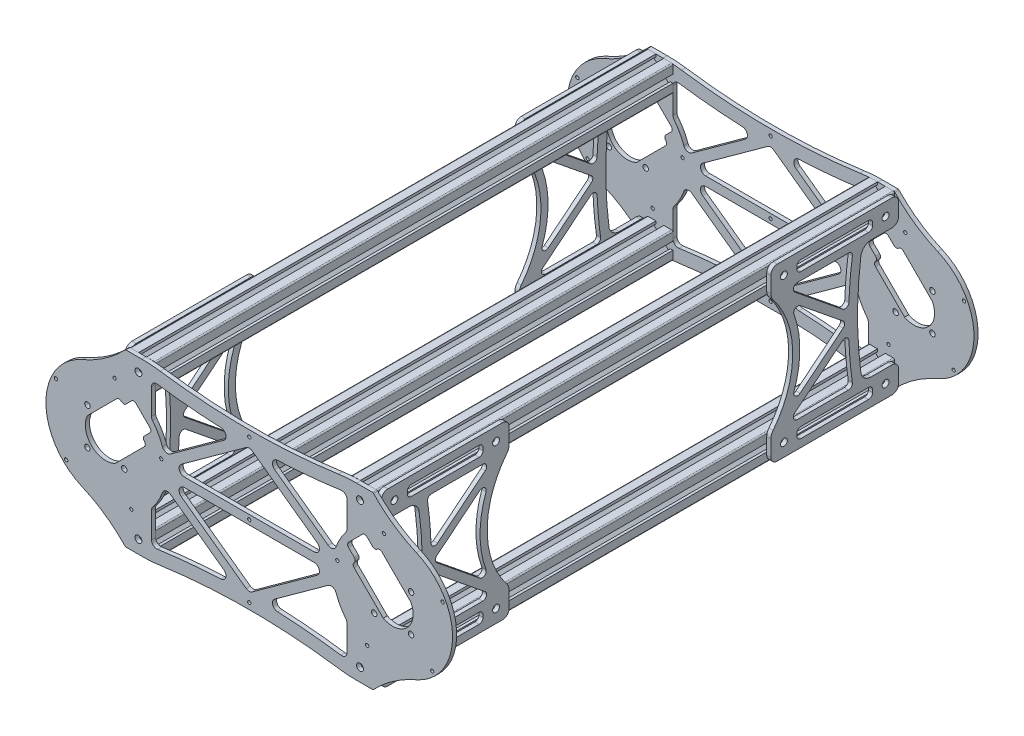
from build123d import *

# Parameters (mm, degrees)
MOTOR_START                           = -31.175
MOTOR_PATTERN_OUTLINE_R               = 46
MOTOR_PATTERN_OUTLINE_R_2             = 1.245
MOTOR_PATTERN_OUTLINE_R_3             = 2.1
MOTOR_PATTERN_DEPTH                   = 3.175
SKETCH1_R                             = 2.65
END_PLATE_CONNECT_DEPTH               = 3.175
END_PLATE_HOLLOWING_DEPTH             = 170.217163245
END_PLATE_HOLLOWING_DEPTH_BACK        = 170.217163245
END_PLATE_TRUSS_DEPTH                 = 3.175
M3X0_5_TAPPED_HOLE1_D                 = 2.49
END_PLATE_TRUSS_FILLET_R              = 4
END_PLATE_BIG_FILLET_R                = 100
END_PLATE_EXTRUSION_CORNER_FILLET_R   = 1
END_PLATE_EXTRUSION_CORNER_FILLET_2_R = 100
SKETCH13_R                            = 2.1
EXTRUSIONS_DEPTH                      = 396.825
SKETCH13_ON_SEGMENT_2_R               = 2.1
EXTRUSIONS_2_DEPTH                    = 396.825
SKETCH13_ON_SEGMENT_3_R               = 2.1
EXTRUSIONS_3_DEPTH                    = 396.825
SKETCH13_ON_SEGMENT_4_R               = 2.1
EXTRUSIONS_4_DEPTH                    = 396.825
SIDE_PLATE_EXTRUDE_DEPTH              = 3.175
SKETCH15_W                            = 8
SKETCH15_H                            = 58
SIDE_PLATE_HOLLOWING_DEPTH            = 3.175
SIDE_PLATE_TRUSS_DEPTH                = 3.175
SKETCH18_R                            = 2.65
SIDE_PLATE_M5_HOLES_DEPTH             = 3.175
SIDE_PLATE_TRUSS_FILLET_R             = 3
SIDE_PLATE_CORNER_FILLET_R            = 5
SIDE_PLATE_INNER_CORNER_FILLET_R      = 8
I_DESIGNED_EVERYTHING_BAD_OOPS_ANGLE  = 90


# Read off the part's stored shape, not the designer's step: motor pattern
with BuildPart() as part:
    # motor pattern outline → motor pattern (new body)
    with BuildSketch(Plane.XY.offset(MOTOR_START)):
        Circle(MOTOR_PATTERN_OUTLINE_R)
        with Locations((-38.31328054, -19.521591489)):
            Circle(MOTOR_PATTERN_OUTLINE_R_2, mode=Mode.SUBTRACT)
        with Locations((-14.142135624, -14.142135624)):
            Circle(MOTOR_PATTERN_OUTLINE_R_3, mode=Mode.SUBTRACT)
        with Locations((6.726681997, -42.470598646)):
            Circle(MOTOR_PATTERN_OUTLINE_R_2, mode=Mode.SUBTRACT)
        with BuildLine():
            ThreePointArc((11.844038585, -29.521708115), (10.076271632, -30.253941162), (8.308504679, -29.521708115))
            Line((8.308504679, -29.521708115), (-14.002371145, -7.210832291))
            ThreePointArc((-14.002371145, -7.210832291), (-11.136931804, 11.136931804), (7.210832291, 14.002371145))
            Line((7.210832291, 14.002371145), (29.521708115, -8.308504679))
            ThreePointArc((29.521708115, -8.308504679), (30.253941162, -10.076271632), (29.521708115, -11.844038585))
            ThreePointArc((29.521708115, -11.844038585), (28.789475068, -13.611805538), (29.521708115, -15.379572491))
            Line((29.521708115, -15.379572491), (33.764348802, -19.622213178))
            ThreePointArc((33.764348802, -19.622213178), (34.496581849, -21.389980131), (33.764348802, -23.157747084))
            Line((33.764348802, -23.157747084), (23.157747084, -33.764348802))
            ThreePointArc((23.157747084, -33.764348802), (21.389980131, -34.496581849), (19.622213178, -33.764348802))
            Line((19.622213178, -33.764348802), (15.379572491, -29.521708115))
            ThreePointArc((15.379572491, -29.521708115), (13.611805538, -28.789475068), (11.844038585, -29.521708115))
        make_face(mode=Mode.SUBTRACT)
        with Locations((42.470598646, -6.726681997)):
            Circle(MOTOR_PATTERN_OUTLINE_R_2, mode=Mode.SUBTRACT)
        with Locations((-14.142135624, 14.142135624)):
            Circle(MOTOR_PATTERN_OUTLINE_R_3, mode=Mode.SUBTRACT)
        with Locations((-30.405591591, 30.405591591)):
            Circle(MOTOR_PATTERN_OUTLINE_R_2, mode=Mode.SUBTRACT)
        with Locations((14.142135624, 14.142135624)):
            Circle(MOTOR_PATTERN_OUTLINE_R_3, mode=Mode.SUBTRACT)
        with Locations((19.521591489, 38.31328054)):
            Circle(MOTOR_PATTERN_OUTLINE_R_2, mode=Mode.SUBTRACT)
    extrude(amount=MOTOR_PATTERN_DEPTH)


with BuildPart() as part_1:
    # motor pattern move: moved
    add(part.part.moved(Location((0, 110, 0))))


with BuildPart() as body_2:
    # end plate motor pattern: mirrored copy
    add(part_1.part.mirror(Plane.ZX))


with BuildPart() as part_2:
    add(part_1.part)

    # Sketch1 → end plate connect (add)
    with BuildSketch(Plane(origin=(0, 0, -31.175), x_dir=(-1, 0, 0), z_dir=(0, 0, -1))):
        with BuildLine():
            Line((45.48562981, 95), (43.48562981, 95))
            ThreePointArc((43.48562981, 95), (0, 64), (-43.48562981, 95))
            Line((-43.48562981, 95), (-65.48562981, 95))
            Line((-65.48562981, 95), (-65.48562981, 0))
            Line((-65.48562981, 0), (65.48562981, 0))
            Line((65.48562981, 0), (65.48562981, 75))
            Line((65.48562981, 75), (65.48562981, 95))
            Line((65.48562981, 95), (45.48562981, 95))
        make_face()
        with Locations(Location((-55.48562981, 85, 0), (0, 0, 90))):
            Circle(SKETCH1_R, mode=Mode.SUBTRACT)
        with Locations(Location((55.48562981, 85, 0), (0, 0, 90))):
            Circle(SKETCH1_R, mode=Mode.SUBTRACT)
    end_plate_connect = extrude(amount=-END_PLATE_CONNECT_DEPTH)

    # end plate connect mirror: end plate connect across plane
    add(end_plate_connect.mirror(Plane(origin=(0, 0, -28), x_dir=(0, 0, 1), z_dir=(0, 1, 0))))

    # end plate combine: union body 2
    add(body_2.part)

    # Sketch2 → end plate hollowing (cut, two sides: drawn at the far end of the back side and taken through both)
    with BuildSketch(Plane(origin=(0, 0, -31.175), x_dir=(-1, 0, 0), z_dir=(0, 0, -1)).offset(-END_PLATE_HOLLOWING_DEPTH_BACK)):
        with BuildLine():
            ThreePointArc((-55.48562981, 75), (-49.828628142, 0), (-55.48562981, -75))
            Line((-55.48562981, -75), (-29.849623113, -75))
            ThreePointArc((-29.849623113, -75), (0, -64), (29.849623113, -75))
            Line((29.849623113, -75), (55.48562981, -75))
            ThreePointArc((55.48562981, -75), (49.828628142, 0), (55.48562981, 75))
            Line((55.48562981, 75), (29.849623113, 75))
            ThreePointArc((29.849623113, 75), (0, 64), (-29.849623113, 75))
            Line((-29.849623113, 75), (-55.48562981, 75))
        make_face()
        with BuildLine():
            Line((-65.48562981, 75), (-65.48562981, -75))
            ThreePointArc((-65.48562981, -75), (-59.713192726, 0), (-65.48562981, 75))
        make_face()
        with BuildLine():
            ThreePointArc((65.48562981, 75), (59.713192726, 0), (65.48562981, -75))
            Line((65.48562981, -75), (65.48562981, 75))
        make_face()
    extrude(amount=END_PLATE_HOLLOWING_DEPTH + END_PLATE_HOLLOWING_DEPTH_BACK, mode=Mode.SUBTRACT)

    # Sketch3 → end plate truss (add)
    with BuildSketch(Plane(origin=(0, 0, -31.175), x_dir=(-1, 0, 0), z_dir=(0, 0, -1))):
        with BuildLine():
            ThreePointArc((-55.664042461, 2.051932173), (-52.828628142, 3.5), (-49.993213824, 2.051932173))
            Line((-49.993213824, 2.051932173), (-48.508271882, 0))
            Line((-48.508271882, 0), (-3.5, 62.193624232))
            Line((-3.5, 62.193624232), (-3.5, 64.133345446))
            ThreePointArc((-3.5, 64.133345446), (-6.783579024, 64.502933549), (-10.032155015, 65.107284937))
            Line((-10.032155015, 65.107284937), (-55.664042461, 2.051932173))
        make_face()
        with BuildLine():
            Line((-3.5, 62.193624232), (-3.5, -62.193624232))
            Line((-3.5, -62.193624232), (-2.156172123, -64.050561246))
            ThreePointArc((-2.156172123, -64.050561246), (0, -64), (2.156172123, -64.050561246))
            Line((2.156172123, -64.050561246), (3.5, -62.193624232))
            Line((3.5, -62.193624232), (3.5, 62.193624232))
            Line((3.5, 62.193624232), (2.156172123, 64.050561246))
            ThreePointArc((2.156172123, 64.050561246), (0, 64), (-2.156172123, 64.050561246))
            Line((-2.156172123, 64.050561246), (-3.5, 62.193624232))
        make_face()
        with BuildLine():
            Line((3.5, 64.133345446), (3.5, 62.193624232))
            Line((3.5, 62.193624232), (48.508271882, 0))
            Line((48.508271882, 0), (49.993213824, 2.051932173))
            ThreePointArc((49.993213824, 2.051932173), (52.828628142, 3.5), (55.664042461, 2.051932173))
            Line((55.664042461, 2.051932173), (10.032155015, 65.107284937))
            ThreePointArc((10.032155015, 65.107284937), (6.783579024, 64.502933549), (3.5, 64.133345446))
        make_face()
        with BuildLine():
            ThreePointArc((3.5, 64.133345446), (2.828388955, 64.087036516), (2.156172123, 64.050561246))
            Line((2.156172123, 64.050561246), (3.5, 62.193624232))
            Line((3.5, 62.193624232), (3.5, 64.133345446))
        make_face()
        with BuildLine():
            Line((-3.5, 64.133345446), (-3.5, 62.193624232))
            Line((-3.5, 62.193624232), (-2.156172123, 64.050561246))
            ThreePointArc((-2.156172123, 64.050561246), (-2.828388955, 64.087036516), (-3.5, 64.133345446))
        make_face()
        with BuildLine():
            Line((-48.508271882, 0), (-49.993213824, 2.051932173))
            ThreePointArc((-49.993213824, 2.051932173), (-52.828628142, 3.5), (-55.664042461, 2.051932173))
            ThreePointArc((-55.664042461, 2.051932173), (-56.328628142, 0), (-55.664042461, -2.051932173))
            ThreePointArc((-55.664042461, -2.051932173), (-52.828628142, -3.5), (-49.993213824, -2.051932173))
            Line((-49.993213824, -2.051932173), (-48.508271882, 0))
        make_face()
        with BuildLine():
            Line((-3.5, -62.193624232), (-48.508271882, 0))
            Line((-48.508271882, 0), (-49.993213824, -2.051932173))
            ThreePointArc((-49.993213824, -2.051932173), (-52.828628142, -3.5), (-55.664042461, -2.051932173))
            Line((-55.664042461, -2.051932173), (-10.032155015, -65.107284937))
            ThreePointArc((-10.032155015, -65.107284937), (-6.783579024, -64.502933549), (-3.5, -64.133345446))
            Line((-3.5, -64.133345446), (-3.5, -62.193624232))
        make_face()
        with BuildLine():
            Line((49.993213824, 2.051932173), (48.508271882, 0))
            Line((48.508271882, 0), (49.993213824, -2.051932173))
            ThreePointArc((49.993213824, -2.051932173), (52.828628142, -3.5), (55.664042461, -2.051932173))
            ThreePointArc((55.664042461, -2.051932173), (56.328628142, 0), (55.664042461, 2.051932173))
            ThreePointArc((55.664042461, 2.051932173), (52.828628142, 3.5), (49.993213824, 2.051932173))
        make_face()
        with BuildLine():
            Line((48.508271882, 0), (3.5, -62.193624232))
            Line((3.5, -62.193624232), (3.5, -64.133345446))
            ThreePointArc((3.5, -64.133345446), (6.783579024, -64.502933549), (10.032155015, -65.107284937))
            Line((10.032155015, -65.107284937), (55.664042461, -2.051932173))
            ThreePointArc((55.664042461, -2.051932173), (52.828628142, -3.5), (49.993213824, -2.051932173))
            Line((49.993213824, -2.051932173), (48.508271882, 0))
        make_face()
        with BuildLine():
            Line((-2.156172123, -64.050561246), (-3.5, -62.193624232))
            Line((-3.5, -62.193624232), (-3.5, -64.133345446))
            ThreePointArc((-3.5, -64.133345446), (-2.828388955, -64.087036516), (-2.156172123, -64.050561246))
        make_face()
        with BuildLine():
            Line((3.5, -62.193624232), (2.156172123, -64.050561246))
            ThreePointArc((2.156172123, -64.050561246), (2.828388955, -64.087036516), (3.5, -64.133345446))
            Line((3.5, -64.133345446), (3.5, -62.193624232))
        make_face()
    extrude(amount=-END_PLATE_TRUSS_DEPTH)

    # M3x0.5 Tapped Hole1 (through all)
    with Locations(Plane(origin=(0, 0, -31.175), x_dir=(-1, 0, 0), z_dir=(0, 0, -1))):
        with Locations((-55, 0), (0, 0), (55, 0)):
            Hole(M3X0_5_TAPPED_HOLE1_D / 2)

    # end plate truss fillet
    end_plate_truss_fillet_edges = [part_2.edges().sort_by_distance(p)[0] for p in [
        (-55.48562981, -75, -29.5875),
        (-29.849623113, -75, -29.5875),
        (29.849623113, -75, -29.5875),
        (55.48562981, -75, -29.5875),
        (55.48562981, 75, -29.5875),
        (29.849623113, 75, -29.5875),
        (-29.849623113, 75, -29.5875),
        (-55.48562981, 75, -29.5875),
        (-49.928196083, -9.977876879, -29.5875),
        (-49.928196083, 9.977876879, -29.5875),
        (49.928196083, -9.977876879, -29.5875),
        (10.032155015, -65.107284937, -29.5875),
        (49.928196083, 9.977876879, -29.5875),
        (-10.032155015, 65.107284937, -29.5875),
        (-3.5, -62.193624232, -29.5875),
        (-3.5, 62.193624232, -29.5875),
        (-48.508271882, 0, -29.5875),
        (10.032155015, 65.107284937, -29.5875),
        (-10.032155015, -65.107284937, -29.5875),
        (48.508271882, 0, -29.5875),
        (3.5, 62.193624232, -29.5875),
        (3.5, -62.193624232, -29.5875),
    ]]
    fillet(end_plate_truss_fillet_edges, radius=END_PLATE_TRUSS_FILLET_R)

    # end plate big fillet
    # the kernel refuses this fillet: 100 mm, written as the material it adds along each edge
    with BuildSketch(Plane(origin=(43.48562981, 95, -31.175), x_dir=(1, 0, 0), z_dir=(0, 0, 1))) as end_plate_big_fillet_piece_1:
        with BuildLine():
            CenterArc((90.605076646, 72.755367213), END_PLATE_BIG_FILLET_R, 203.302445724, 23.379254169)
            ThreePointArc((-1.237872981, 33.196896519), (2.482423018, 16.714094285), (0, 0))
            Line((0, 0), (22, 0))
        make_face()
    extrude(amount=3.175)
    with BuildSketch(Plane(origin=(-43.48562981, 95, -31.175), x_dir=(-1, 0, 0), z_dir=(0, 0, 1))) as end_plate_big_fillet_piece_2:
        with BuildLine():
            CenterArc((90.605076646, -72.755367213), END_PLATE_BIG_FILLET_R, 133.318300107, 23.379254169)
            ThreePointArc((-1.237872981, -33.196896519), (2.482423018, -16.714094285), (0, 0))
            Line((0, 0), (22, 0))
        make_face()
    extrude(amount=3.175)
    with BuildSketch(Plane(origin=(-43.48562981, -95, -31.175), x_dir=(0.03726291924188366, -0.9993054962570621, 0), z_dir=(0, 0, 1))) as end_plate_big_fillet_piece_3:
        with BuildLine():
            CenterArc((69.328628684, -93.253228454), END_PLATE_BIG_FILLET_R, 111.166943324, 23.379254169)
            Line((-0.819784223, -21.984720918), (0, 0))
            ThreePointArc((0, 0), (16.609983956, -3.103514911), (33.219967911, 0))
        make_face()
    extrude(amount=3.175)
    with BuildSketch(Plane(origin=(43.48562981, -95, -31.175), x_dir=(-0.03726291924188323, -0.9993054962570621, 0), z_dir=(0, 0, 1))) as end_plate_big_fillet_piece_4:
        with BuildLine():
            CenterArc((69.328628684, 93.253228454), END_PLATE_BIG_FILLET_R, 225.453802506, 23.379254169)
            Line((-0.819784223, 21.984720918), (0, 0))
            ThreePointArc((0, 0), (16.609983956, 3.103514911), (33.219967911, 0))
        make_face()
    extrude(amount=3.175)

    # end plate extrusion corner fillet
    end_plate_extrusion_corner_fillet_edges = [part_2.edges().sort_by_distance(p)[0] for p in [
        (-65.48562981, 95, -29.5875),
        (65.48562981, 95, -29.5875),
        (65.48562981, -95, -29.5875),
        (-65.48562981, -95, -29.5875),
    ]]
    fillet(end_plate_extrusion_corner_fillet_edges, radius=END_PLATE_EXTRUSION_CORNER_FILLET_R)

    # end plate extrusion corner fillet 2
    end_plate_extrusion_corner_fillet_2_edges = [part_2.edges().sort_by_distance(p)[0] for p in [
        (-65.48562981, 75, -29.5875),
        (-65.48562981, -75, -29.5875),
        (65.48562981, -75, -29.5875),
        (65.48562981, 75, -29.5875),
    ]]
    fillet(end_plate_extrusion_corner_fillet_2_edges, radius=END_PLATE_EXTRUSION_CORNER_FILLET_2_R)


with BuildPart() as body_2_2:
    # end plate copy: copy of part
    add(part_2.part.moved(Location((0, 0, 400))))


with BuildPart() as body_3:
    # Sketch13 → extrusions (new body)
    with BuildSketch(Plane(origin=(55.48562981, 85, -28), x_dir=(1, 0, 0), z_dir=(0, 0, 1))):
        with BuildLine():
            Line((-3, 10), (-9, 10))
            ThreePointArc((-9, 10), (-9.707106781, 9.707106781), (-10, 9))
            Line((-10, 9), (-10, 3))
            Line((-10, 3), (-8, 3))
            Line((-8, 3), (-8, 6))
            Line((-8, 6), (-4, 2))
            Line((-4, 2), (-4, -2))
            Line((-4, -2), (-8, -6))
            Line((-8, -6), (-8, -3))
            Line((-8, -3), (-10, -3))
            Line((-10, -3), (-10, -9))
            ThreePointArc((-10, -9), (-9.707106781, -9.707106781), (-9, -10))
            Line((-9, -10), (-3, -10))
            Line((-3, -10), (-3, -8))
            Line((-3, -8), (-6, -8))
            Line((-6, -8), (-2, -4))
            Line((-2, -4), (2, -4))
            Line((2, -4), (6, -8))
            Line((6, -8), (3, -8))
            Line((3, -8), (3, -10))
            Line((3, -10), (9, -10))
            ThreePointArc((9, -10), (9.707106781, -9.707106781), (10, -9))
            Line((10, -9), (10, -3))
            Line((10, -3), (8, -3))
            Line((8, -3), (8, -6))
            Line((8, -6), (4, -2))
            Line((4, -2), (4, 2))
            Line((4, 2), (8, 6))
            Line((8, 6), (8, 3))
            Line((8, 3), (10, 3))
            Line((10, 3), (10, 9))
            ThreePointArc((10, 9), (9.707106781, 9.707106781), (9, 10))
            Line((9, 10), (3, 10))
            Line((3, 10), (3, 8))
            Line((3, 8), (6, 8))
            Line((6, 8), (2, 4))
            Line((2, 4), (-2, 4))
            Line((-2, 4), (-6, 8))
            Line((-6, 8), (-3, 8))
            Line((-3, 8), (-3, 10))
        make_face()
        Circle(SKETCH13_R, mode=Mode.SUBTRACT)
    extrude(amount=EXTRUSIONS_DEPTH)


with BuildPart() as body_4:
    # Sketch13 on segment 2 (carried to segment 2) → extrusions 2 (new body)
    with BuildSketch(Plane(origin=(55.48562981, -85, -28), x_dir=(1, 0, 0), z_dir=(0, 0, 1))):
        with BuildLine():
            Line((-3, 10), (-9, 10))
            ThreePointArc((-9, 10), (-9.707106781, 9.707106781), (-10, 9))
            Line((-10, 9), (-10, 3))
            Line((-10, 3), (-8, 3))
            Line((-8, 3), (-8, 6))
            Line((-8, 6), (-4, 2))
            Line((-4, 2), (-4, -2))
            Line((-4, -2), (-8, -6))
            Line((-8, -6), (-8, -3))
            Line((-8, -3), (-10, -3))
            Line((-10, -3), (-10, -9))
            ThreePointArc((-10, -9), (-9.707106781, -9.707106781), (-9, -10))
            Line((-9, -10), (-3, -10))
            Line((-3, -10), (-3, -8))
            Line((-3, -8), (-6, -8))
            Line((-6, -8), (-2, -4))
            Line((-2, -4), (2, -4))
            Line((2, -4), (6, -8))
            Line((6, -8), (3, -8))
            Line((3, -8), (3, -10))
            Line((3, -10), (9, -10))
            ThreePointArc((9, -10), (9.707106781, -9.707106781), (10, -9))
            Line((10, -9), (10, -3))
            Line((10, -3), (8, -3))
            Line((8, -3), (8, -6))
            Line((8, -6), (4, -2))
            Line((4, -2), (4, 2))
            Line((4, 2), (8, 6))
            Line((8, 6), (8, 3))
            Line((8, 3), (10, 3))
            Line((10, 3), (10, 9))
            ThreePointArc((10, 9), (9.707106781, 9.707106781), (9, 10))
            Line((9, 10), (3, 10))
            Line((3, 10), (3, 8))
            Line((3, 8), (6, 8))
            Line((6, 8), (2, 4))
            Line((2, 4), (-2, 4))
            Line((-2, 4), (-6, 8))
            Line((-6, 8), (-3, 8))
            Line((-3, 8), (-3, 10))
        make_face()
        Circle(SKETCH13_ON_SEGMENT_2_R, mode=Mode.SUBTRACT)
    extrude(amount=EXTRUSIONS_2_DEPTH)


with BuildPart() as body_5:
    # Sketch13 on segment 3 (carried to segment 3) → extrusions 3 (new body)
    with BuildSketch(Plane(origin=(-55.48562981, 85, -28), x_dir=(1, 0, 0), z_dir=(0, 0, 1))):
        with BuildLine():
            Line((-3, 10), (-9, 10))
            ThreePointArc((-9, 10), (-9.707106781, 9.707106781), (-10, 9))
            Line((-10, 9), (-10, 3))
            Line((-10, 3), (-8, 3))
            Line((-8, 3), (-8, 6))
            Line((-8, 6), (-4, 2))
            Line((-4, 2), (-4, -2))
            Line((-4, -2), (-8, -6))
            Line((-8, -6), (-8, -3))
            Line((-8, -3), (-10, -3))
            Line((-10, -3), (-10, -9))
            ThreePointArc((-10, -9), (-9.707106781, -9.707106781), (-9, -10))
            Line((-9, -10), (-3, -10))
            Line((-3, -10), (-3, -8))
            Line((-3, -8), (-6, -8))
            Line((-6, -8), (-2, -4))
            Line((-2, -4), (2, -4))
            Line((2, -4), (6, -8))
            Line((6, -8), (3, -8))
            Line((3, -8), (3, -10))
            Line((3, -10), (9, -10))
            ThreePointArc((9, -10), (9.707106781, -9.707106781), (10, -9))
            Line((10, -9), (10, -3))
            Line((10, -3), (8, -3))
            Line((8, -3), (8, -6))
            Line((8, -6), (4, -2))
            Line((4, -2), (4, 2))
            Line((4, 2), (8, 6))
            Line((8, 6), (8, 3))
            Line((8, 3), (10, 3))
            Line((10, 3), (10, 9))
            ThreePointArc((10, 9), (9.707106781, 9.707106781), (9, 10))
            Line((9, 10), (3, 10))
            Line((3, 10), (3, 8))
            Line((3, 8), (6, 8))
            Line((6, 8), (2, 4))
            Line((2, 4), (-2, 4))
            Line((-2, 4), (-6, 8))
            Line((-6, 8), (-3, 8))
            Line((-3, 8), (-3, 10))
        make_face()
        Circle(SKETCH13_ON_SEGMENT_3_R, mode=Mode.SUBTRACT)
    extrude(amount=EXTRUSIONS_3_DEPTH)


with BuildPart() as body_6:
    # Sketch13 on segment 4 (carried to segment 4) → extrusions 4 (new body)
    with BuildSketch(Plane(origin=(-55.48562981, -85, -28), x_dir=(1, 0, 0), z_dir=(0, 0, 1))):
        with BuildLine():
            Line((-3, 10), (-9, 10))
            ThreePointArc((-9, 10), (-9.707106781, 9.707106781), (-10, 9))
            Line((-10, 9), (-10, 3))
            Line((-10, 3), (-8, 3))
            Line((-8, 3), (-8, 6))
            Line((-8, 6), (-4, 2))
            Line((-4, 2), (-4, -2))
            Line((-4, -2), (-8, -6))
            Line((-8, -6), (-8, -3))
            Line((-8, -3), (-10, -3))
            Line((-10, -3), (-10, -9))
            ThreePointArc((-10, -9), (-9.707106781, -9.707106781), (-9, -10))
            Line((-9, -10), (-3, -10))
            Line((-3, -10), (-3, -8))
            Line((-3, -8), (-6, -8))
            Line((-6, -8), (-2, -4))
            Line((-2, -4), (2, -4))
            Line((2, -4), (6, -8))
            Line((6, -8), (3, -8))
            Line((3, -8), (3, -10))
            Line((3, -10), (9, -10))
            ThreePointArc((9, -10), (9.707106781, -9.707106781), (10, -9))
            Line((10, -9), (10, -3))
            Line((10, -3), (8, -3))
            Line((8, -3), (8, -6))
            Line((8, -6), (4, -2))
            Line((4, -2), (4, 2))
            Line((4, 2), (8, 6))
            Line((8, 6), (8, 3))
            Line((8, 3), (10, 3))
            Line((10, 3), (10, 9))
            ThreePointArc((10, 9), (9.707106781, 9.707106781), (9, 10))
            Line((9, 10), (3, 10))
            Line((3, 10), (3, 8))
            Line((3, 8), (6, 8))
            Line((6, 8), (2, 4))
            Line((2, 4), (-2, 4))
            Line((-2, 4), (-6, 8))
            Line((-6, 8), (-3, 8))
            Line((-3, 8), (-3, 10))
        make_face()
        Circle(SKETCH13_ON_SEGMENT_4_R, mode=Mode.SUBTRACT)
    extrude(amount=EXTRUSIONS_4_DEPTH)


with BuildPart() as body_7:
    # Sketch14 → side plate extrude (new body)
    with BuildSketch(Plane.XZ.offset(95)):
        with BuildLine():
            Line((-45.48562981, 368.825), (-65.48562981, 368.825))
            Line((-65.48562981, 368.825), (-65.48562981, 270.825))
            Line((-65.48562981, 270.825), (-45.48562981, 270.825))
            ThreePointArc((-45.48562981, 270.825), (0, 287.617317465), (45.48562981, 270.825))
            Line((45.48562981, 270.825), (65.48562981, 270.825))
            Line((65.48562981, 270.825), (65.48562981, 368.825))
            Line((65.48562981, 368.825), (45.48562981, 368.825))
            Line((45.48562981, 368.825), (45.48562981, 340.825))
            ThreePointArc((45.48562981, 340.825), (0, 337.356714123), (-45.48562981, 340.825))
            Line((-45.48562981, 340.825), (-45.48562981, 368.825))
        make_face()
    extrude(amount=SIDE_PLATE_EXTRUDE_DEPTH)

    # Sketch15 → side plate hollowing (cut)
    with BuildSketch(Plane.XZ.offset(98.175)):
        with BuildLine():
            ThreePointArc((45.48562981, 333.825), (0, 330.435805748), (-45.48562981, 333.825))
            Line((-45.48562981, 333.825), (-45.48562981, 277.825))
            ThreePointArc((-45.48562981, 277.825), (0, 293.075302831), (45.48562981, 277.825))
            Line((45.48562981, 277.825), (45.48562981, 333.825))
        make_face()
        with Locations((55.48562981, 319.825)):
            Rectangle(SKETCH15_W, SKETCH15_H)
        with Locations((-55.48562981, 319.825)):
            Rectangle(SKETCH15_W, SKETCH15_H)
    extrude(amount=-SIDE_PLATE_HOLLOWING_DEPTH, mode=Mode.SUBTRACT)

    # Sketch16 → side plate truss (add)
    with BuildSketch(Plane.XZ.offset(98.175)):
        with BuildLine():
            Line((-47.816092466, 279.714164845), (-2.330462656, 335.824970593))
            ThreePointArc((-2.330462656, 335.824970593), (1.889164845, 336.266268404), (2.330462656, 332.046640903))
            Line((2.330462656, 332.046640903), (-43.155167155, 275.935835155))
            ThreePointArc((-43.155167155, 275.935835155), (-47.374794655, 275.494537344), (-47.816092466, 279.714164845))
        make_face()
        with BuildLine():
            Line((43.155167155, 275.935835155), (-2.330462656, 332.046640903))
            ThreePointArc((-2.330462656, 332.046640903), (-1.889164845, 336.266268404), (2.330462656, 335.824970593))
            Line((2.330462656, 335.824970593), (47.816092466, 279.714164845))
            ThreePointArc((47.816092466, 279.714164845), (47.374794655, 275.494537344), (43.155167155, 275.935835155))
        make_face()
    extrude(amount=-SIDE_PLATE_TRUSS_DEPTH)

    # Sketch18 → side plate m5 holes (cut)
    with BuildSketch(Plane.XZ.offset(98.175)):
        with Locations(Location((-55.48562981, 358.825, 0), (0, 0, 270))):
            Circle(SKETCH18_R)
        with Locations(Location((-55.48562981, 280.825, 0), (0, 0, 270))):
            Circle(SKETCH18_R)
        with Locations(Location((55.48562981, 280.825, 0), (0, 0, 90))):
            Circle(SKETCH18_R)
        with Locations(Location((55.48562981, 358.825, 0), (0, 0, 90))):
            Circle(SKETCH18_R)
    extrude(amount=-SIDE_PLATE_M5_HOLES_DEPTH, mode=Mode.SUBTRACT)

    # side plate truss fillet
    side_plate_truss_fillet_edges = [body_7.edges().sort_by_distance(p)[0] for p in [
        (45.48562981, -96.5875, 282.589009887),
        (37.220505486, -96.5875, 283.256798929),
        (0, -96.5875, 329.171795861),
        (-37.220505486, -96.5875, 283.256798929),
        (-45.48562981, -96.5875, 282.589009887),
        (-6.640884946, -96.5875, 330.507658976),
        (6.640884946, -96.5875, 330.507658976),
        (59.48562981, -96.5875, 348.825),
        (59.48562981, -96.5875, 290.825),
        (51.48562981, -96.5875, 290.825),
        (51.48562981, -96.5875, 348.825),
        (-45.48562981, -96.5875, 333.825),
        (45.48562981, -96.5875, 333.825),
        (-51.48562981, -96.5875, 290.825),
        (-59.48562981, -96.5875, 290.825),
        (-59.48562981, -96.5875, 348.825),
        (-51.48562981, -96.5875, 348.825),
    ]]
    fillet(side_plate_truss_fillet_edges, radius=SIDE_PLATE_TRUSS_FILLET_R)

    # side plate corner fillet
    side_plate_corner_fillet_edges = [body_7.edges().sort_by_distance(p)[0] for p in [
        (65.48562981, -96.5875, 270.825),
        (-65.48562981, -96.5875, 270.825),
        (-65.48562981, -96.5875, 368.825),
        (-45.48562981, -96.5875, 368.825),
        (45.48562981, -96.5875, 368.825),
        (65.48562981, -96.5875, 368.825),
    ]]
    fillet(side_plate_corner_fillet_edges, radius=SIDE_PLATE_CORNER_FILLET_R)

    # side plate inner corner fillet
    side_plate_inner_corner_fillet_edges = [body_7.edges().sort_by_distance(p)[0] for p in [
        (45.48562981, -96.5875, 270.825),
        (-45.48562981, -96.5875, 270.825),
        (-45.48562981, -96.5875, 340.825),
        (45.48562981, -96.5875, 340.825),
    ]]
    fillet(side_plate_inner_corner_fillet_edges, radius=SIDE_PLATE_INNER_CORNER_FILLET_R)


with BuildPart() as body_8:
    # side plate mirror 1: mirrored copy
    add(body_7.part.mirror(Plane(origin=(0, 0, 170.4125), x_dir=(1, 0, 0), z_dir=(0, 0, -1))))


with BuildPart() as body_9:
    # side plate mirror 2: mirrored copy
    add(body_7.part.mirror(Plane.ZX))


with BuildPart() as body_10:
    # side plate mirror 2 2: mirrored copy
    add(body_8.part.mirror(Plane.ZX))


with BuildPart() as body_2_2_1:
    # i designed everything bad oops: moved
    add(body_2_2.part.rotate(Axis((0, 0, 0), (0, 0, 1)), I_DESIGNED_EVERYTHING_BAD_OOPS_ANGLE))


with BuildPart() as body_3_1:
    # i designed everything bad oops: moved
    add(body_3.part.rotate(Axis((0, 0, 0), (0, 0, 1)), I_DESIGNED_EVERYTHING_BAD_OOPS_ANGLE))


with BuildPart() as body_9_1:
    # i designed everything bad oops: moved
    add(body_9.part.rotate(Axis((0, 0, 0), (0, 0, 1)), I_DESIGNED_EVERYTHING_BAD_OOPS_ANGLE))


with BuildPart() as body_5_1:
    # i designed everything bad oops: moved
    add(body_5.part.rotate(Axis((0, 0, 0), (0, 0, 1)), I_DESIGNED_EVERYTHING_BAD_OOPS_ANGLE))


with BuildPart() as body_6_1:
    # i designed everything bad oops: moved
    add(body_6.part.rotate(Axis((0, 0, 0), (0, 0, 1)), I_DESIGNED_EVERYTHING_BAD_OOPS_ANGLE))


with BuildPart() as body_7_1:
    # i designed everything bad oops: moved
    add(body_7.part.rotate(Axis((0, 0, 0), (0, 0, 1)), I_DESIGNED_EVERYTHING_BAD_OOPS_ANGLE))


with BuildPart() as body_4_1:
    # i designed everything bad oops: moved
    add(body_4.part.rotate(Axis((0, 0, 0), (0, 0, 1)), I_DESIGNED_EVERYTHING_BAD_OOPS_ANGLE))


with BuildPart() as part_3:
    # i designed everything bad oops: moved
    add(part_2.part.rotate(Axis((0, 0, 0), (0, 0, 1)), I_DESIGNED_EVERYTHING_BAD_OOPS_ANGLE))


with BuildPart() as body_10_1:
    # i designed everything bad oops: moved
    add(body_10.part.rotate(Axis((0, 0, 0), (0, 0, 1)), I_DESIGNED_EVERYTHING_BAD_OOPS_ANGLE))


with BuildPart() as body_8_1:
    # i designed everything bad oops: moved
    add(body_8.part.rotate(Axis((0, 0, 0), (0, 0, 1)), I_DESIGNED_EVERYTHING_BAD_OOPS_ANGLE))


solid = Compound([body_2_2_1.part, body_3_1.part, body_9_1.part, body_5_1.part, body_6_1.part, body_7_1.part, body_4_1.part, part_3.part, body_10_1.part, body_8_1.part])
